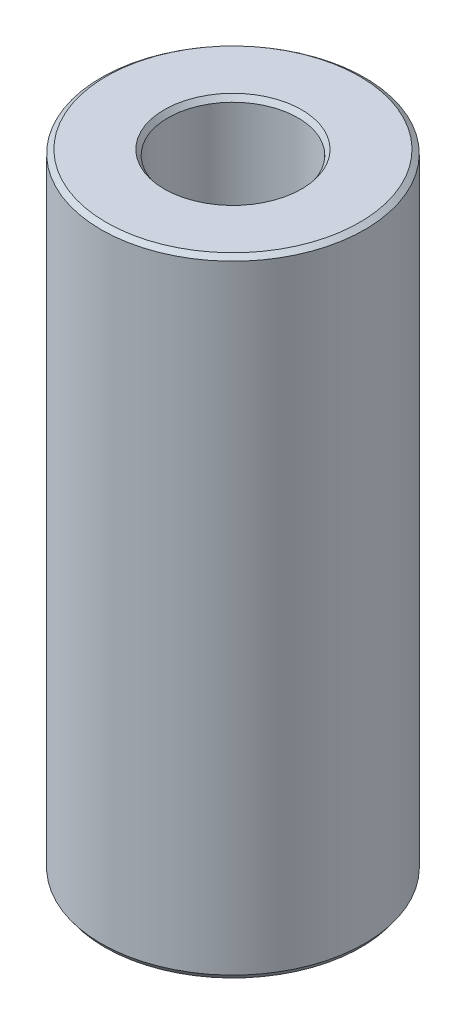
from build123d import *
from OCP.BRepFilletAPI import BRepFilletAPI_MakeChamfer

# Parameters (mm, degrees)
SKETCH1_R           = 37.5
BOSS_EXTRUDE1_DEPTH = 178.489777708
SKETCH2_R           = 18.495709262
CUT_EXTRUDE1_DEPTH  = 187.201774284
CHAMFER1_SIZE       = 1.058820797
CHAMFER1_SIZE2      = 1.459134101


with BuildPart() as part:
    # Sketch1 → Boss-Extrude1 (new body)
    with BuildSketch(Plane(origin=(0, 0, 0), x_dir=(1, 0, 0), z_dir=(0, 1, 0))):
        Circle(SKETCH1_R)
    extrude(amount=BOSS_EXTRUDE1_DEPTH)

    # Sketch2 → Cut-Extrude1 (cut, through all)
    with BuildSketch(Plane(origin=(0, 0, 0), x_dir=(1, 0, 0), z_dir=(0, 1, 0))):
        Circle(SKETCH2_R)
    extrude(amount=CUT_EXTRUDE1_DEPTH, mode=Mode.SUBTRACT)

    # Chamfer1: one chamfer whose edges measure the first distance from different faces: ONE call of the kernel's chamfer builder (chamfer() names one face for all edges)
    chamfer1_edges_1 = [part.edges().sort_by_distance(p)[0] for p in [
        (-18.495709262, 178.489777708, 0),
    ]]
    chamfer1_side_1 = [part.faces().sort_by_distance(p)[0] for p in [
        (-36.439339828, 178.489777708, 0),
    ]]
    chamfer1_edges_2 = [part.edges().sort_by_distance(p)[0] for p in [
        (-18.495709262, 0, 0),
    ]]
    chamfer1_side_2 = [part.faces().sort_by_distance(p)[0] for p in [
        (-18.495709262, 89.244888854, 0),
    ]]
    chamfer1_edges_3 = [part.edges().sort_by_distance(p)[0] for p in [
        (-37.5, 0, 0),
    ]]
    chamfer1_side_3 = [part.faces().sort_by_distance(p)[0] for p in [
        (-36.439339828, 0, 0),
    ]]
    chamfer1_edges_4 = [part.edges().sort_by_distance(p)[0] for p in [
        (-37.5, 178.489777708, 0),
    ]]
    chamfer1_side_4 = [part.faces().sort_by_distance(p)[0] for p in [
        (-37.5, 89.244888854, 0),
    ]]
    chamfer1 = BRepFilletAPI_MakeChamfer(part.part.solid().wrapped)
    for e in chamfer1_edges_1:
        chamfer1.Add(CHAMFER1_SIZE, CHAMFER1_SIZE2, e.wrapped, chamfer1_side_1[0].wrapped)  # the first distance lies on this face
    for e in chamfer1_edges_2:
        chamfer1.Add(CHAMFER1_SIZE, CHAMFER1_SIZE2, e.wrapped, chamfer1_side_2[0].wrapped)  # the first distance lies on this face
    for e in chamfer1_edges_3:
        chamfer1.Add(CHAMFER1_SIZE, CHAMFER1_SIZE2, e.wrapped, chamfer1_side_3[0].wrapped)  # the first distance lies on this face
    for e in chamfer1_edges_4:
        chamfer1.Add(CHAMFER1_SIZE, CHAMFER1_SIZE2, e.wrapped, chamfer1_side_4[0].wrapped)  # the first distance lies on this face
    add(Compound.cast(chamfer1.Shape()), mode=Mode.REPLACE)


solid = part.part
